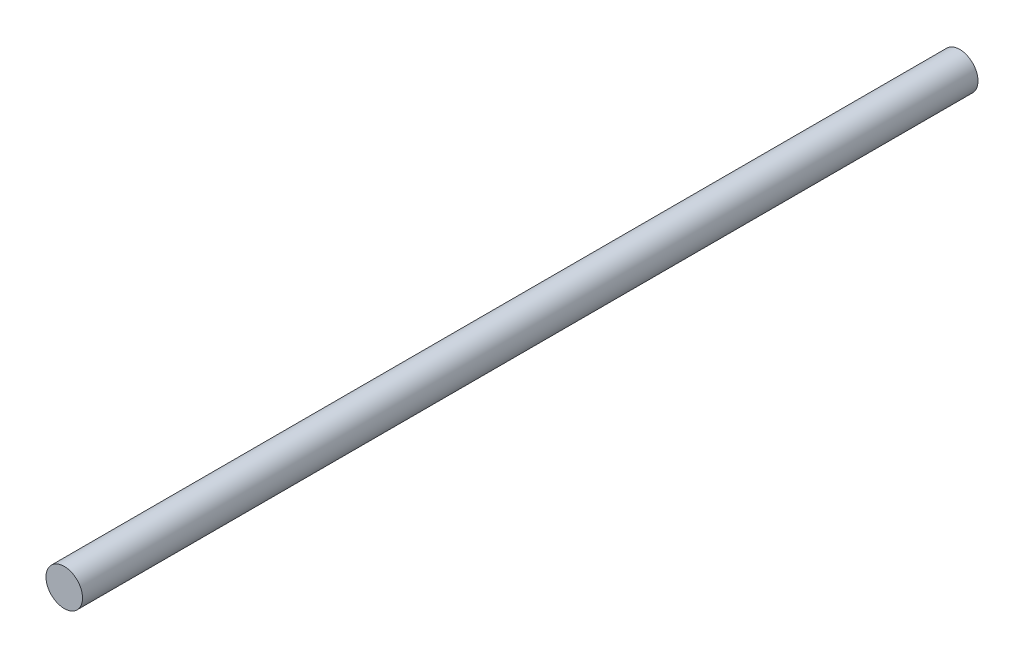
from build123d import *

# Parameters (mm, degrees)
SKETCH1_R           = 6.35
BOSS_EXTRUDE1_DEPTH = 311.15


with BuildPart() as part:
    # Sketch1 → Boss-Extrude1 (new body)
    with BuildSketch(Plane.XY):
        Circle(SKETCH1_R)
    extrude(amount=BOSS_EXTRUDE1_DEPTH)


solid = part.part
